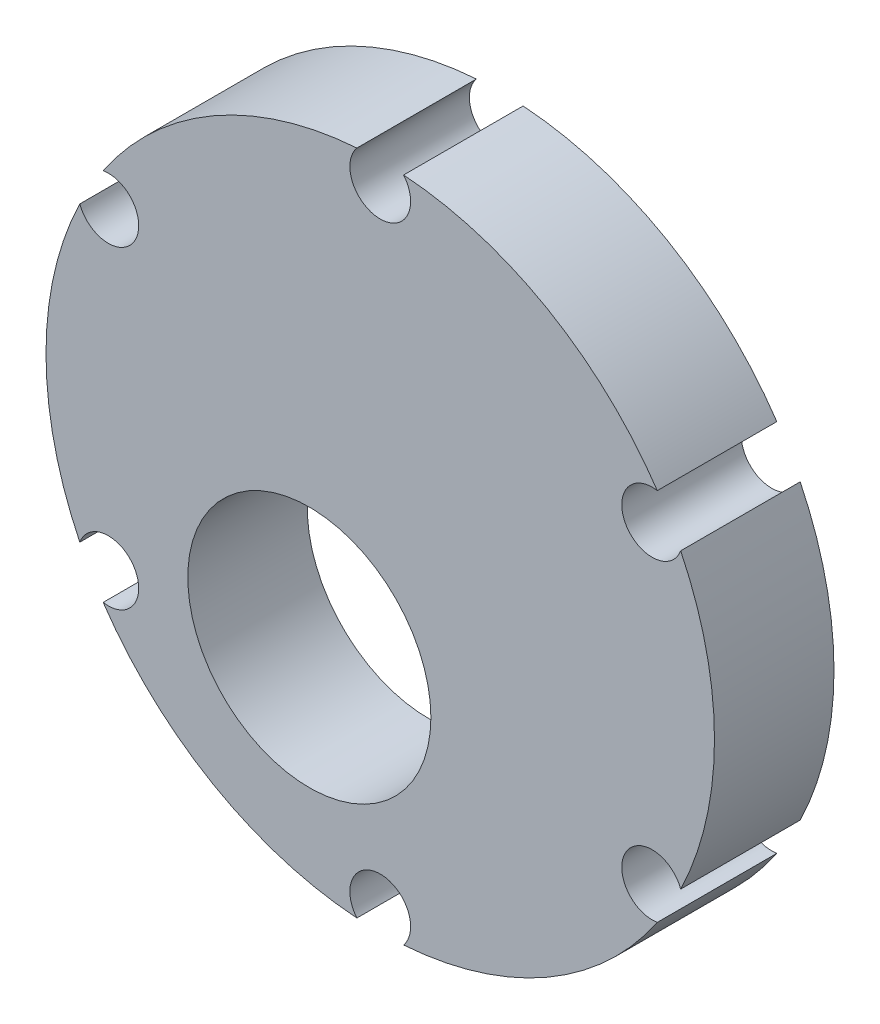
from build123d import *

# Parameters (mm, degrees)
SKETCH1_R           = 16.5
BOSS_EXTRUDE1_DEPTH = 5.9
SKETCH2_R           = 1.5
CUT_EXTRUDE1_DEPTH  = 25.068859549
SKETCH3_R           = 6
CUT_EXTRUDE2_DEPTH  = 25.041235009


with BuildPart() as part:
    # Sketch1 → Boss-Extrude1 (new body)
    with BuildSketch(Plane.XY):
        Circle(SKETCH1_R)
    extrude(amount=BOSS_EXTRUDE1_DEPTH)

    # Sketch2 → Cut-Extrude1 (cut, through all)
    with BuildSketch(Plane.XY.offset(5.9)):
        with Locations((0, 15.5)):
            Circle(SKETCH2_R)
        with Locations((13.423393759, 7.75)):
            Circle(SKETCH2_R)
        with Locations((13.423393759, -7.75)):
            Circle(SKETCH2_R)
        with Locations((0, -15.5)):
            Circle(SKETCH2_R)
        with Locations((-13.423393759, -7.75)):
            Circle(SKETCH2_R)
        with Locations((-13.423393759, 7.75)):
            Circle(SKETCH2_R)
    extrude(amount=-CUT_EXTRUDE1_DEPTH, mode=Mode.SUBTRACT)

    # Sketch3 → Cut-Extrude2 (cut, through all)
    with BuildSketch(Plane.XY.offset(5.9)):
        with Locations((-3.5, -6.062177826)):
            Circle(SKETCH3_R)
    extrude(amount=-CUT_EXTRUDE2_DEPTH, mode=Mode.SUBTRACT)


solid = part.part
